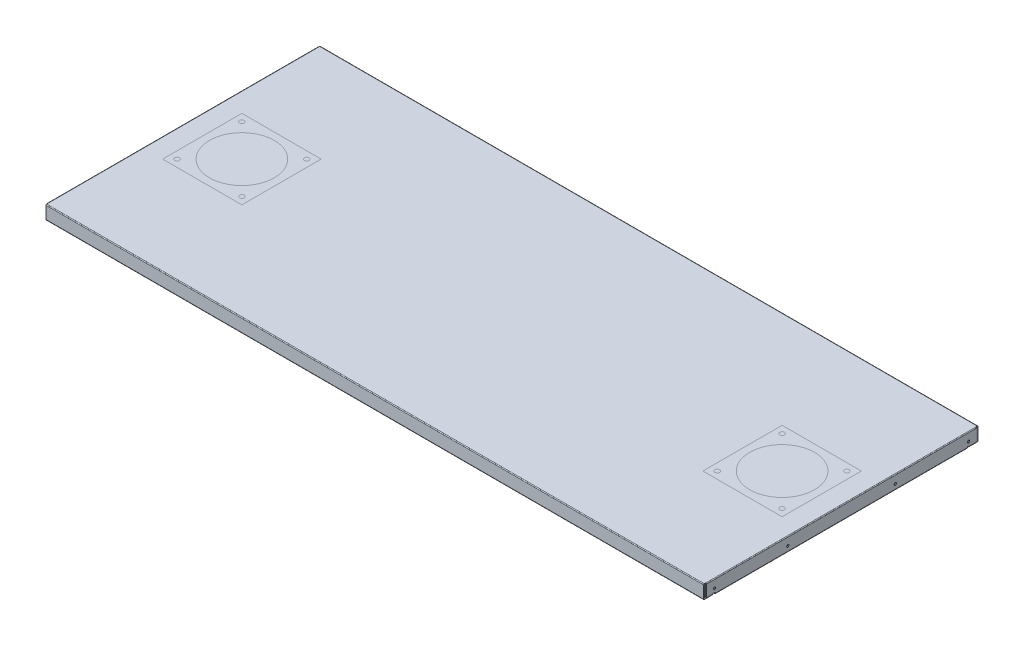
from build123d import *
from build123d.topology import SkipClean

# Parameters (mm, degrees)
BOSS_EXTRUDE1_DEPTH       = 912.8125
BOSS_EXTRUDE2_DEPTH       = 375.44375
BOSS_EXTRUDE2_2_DEPTH     = 375.44375
CUT_EXTRUDE1_DEPTH        = 1870.255613749
CUT_EXTRUDE1_DEPTH_BACK   = 1870.255613749
FILLET1_R                 = 2.06375
FILLET2_R                 = 0.79375
CUT_EXTRUDE4_DEPTH        = 2019.709476188
CUT_EXTRUDE4_DEPTH_BACK   = 2019.709476188
SKETCH10_R                = 3.175
SKETCH11_R                = 3.175
CUT_EXTRUDE5_DEPTH        = 6.35
SKETCH_PATTERN2_START     = -20.32
SKETCH_PATTERN2_OUTLINE_R = 3.175
SKETCH_PATTERN2_DEPTH     = 2.65684
CUT_EXTRUDE6_DEPTH        = 6.35
SKETCH_PATTERN3_START     = -20.32
SKETCH_PATTERN3_DEPTH     = 2.65684
BOSS_EXTRUDE4_DEPTH       = 375.840625
CUT_EXTRUDE7_DEPTH        = 992.742345256
CUT_EXTRUDE7_DEPTH_BACK   = 992.742345256
SKETCH17_R                = 6.35
SKETCH17_R_2              = 3.175
SKETCH18_R                = 5.55625
SKETCH18_R_2              = 3.175
BOSS_EXTRUDE5_DEPTH       = 6.7437
FILLET3_R                 = 3.175
LPATTERN1_COUNT           = 2
LPATTERN1_PITCH           = 1104.10879


# Read off the part's stored shape, not the designer's step: Sketch-Pattern2, Sketch-Pattern3
with BuildPart() as part:
    # Sketch7 → Boss-Extrude1 (new, symmetric)
    with BuildSketch(Plane(origin=(0, 0, 0), x_dir=(0, 0, -1), z_dir=(1, 0, 0))):
        Polygon((-381, 17.78), (381, 17.78), (381, -20.32), (354.95992, -20.32), (354.95992, -17.66316), (378.34316, -17.66316), (378.34316, 15.12316), (-378.34316, 15.12316), (-378.34316, -17.66316), (-354.95992, -17.66316), (-354.95992, -20.32), (-381, -20.32), align=None)
    extrude(amount=BOSS_EXTRUDE1_DEPTH, both=True)


with BuildPart() as body_2:
    # Sketch8 → Boss-Extrude2 (new, symmetric)
    with BuildSketch(Plane.XY):
        Polygon((-914.95118, 17.78), (-914.95118, -20.32), (-886.21362, -20.32), (-886.21362, -17.66316), (-912.29434, -17.66316), (-912.29434, 15.12316), (-908.60118, 15.12316), (-908.60118, 17.78), align=None)
    extrude(amount=BOSS_EXTRUDE2_DEPTH, both=True)


with BuildPart() as body_3:
    # Sketch8 → Boss-Extrude2 2 (new, symmetric)
    with BuildSketch(Plane.XY):
        Polygon((886.21362, -17.66316), (886.21362, -20.32), (914.95118, -20.32), (914.95118, 17.78), (908.60118, 17.78), (908.60118, 15.12316), (912.29434, 15.12316), (912.29434, -17.66316), align=None)
    extrude(amount=BOSS_EXTRUDE2_2_DEPTH, both=True)


with BuildPart() as cut_extrude1_tool:
    # Sketch9 → Cut-Extrude1 (new, two sides: drawn at the far end of the back side and taken through both)
    with BuildSketch(Plane.ZY.offset(914.95118).offset(-CUT_EXTRUDE1_DEPTH_BACK)):
        Polygon((-381, 17.78), (-375.47296, 17.78), (-375.47296, -16.10614), (-350.06788, -16.10614), (-350.06788, -20.32), (-381, -20.32), align=None)
        Polygon((381, -20.32), (381, 17.78), (375.47296, 17.78), (375.47296, -16.10614), (350.06788, -16.10614), (350.06788, -20.32), align=None)
    extrude(amount=CUT_EXTRUDE1_DEPTH + CUT_EXTRUDE1_DEPTH_BACK)


with BuildPart() as body_2_1:
    add(body_2.part)

    # Cut-Extrude1: cut by cut_extrude1_tool
    add(cut_extrude1_tool.part, mode=Mode.SUBTRACT)


with BuildPart() as body_3_1:
    add(body_3.part)

    # Cut-Extrude1: cut by cut_extrude1_tool
    add(cut_extrude1_tool.part, mode=Mode.SUBTRACT)


with BuildPart() as body_2_2:
    add(body_2_1.part)

    # Combine1: union part, body 3
    add(part.part)
    add(body_3_1.part)

    # Fillet1
    fillet1_edges = [body_2_2.edges().sort_by_distance(p)[0] for p in [
        (-914.95118, 17.78, 0),
        (-914.95118, -20.32, 0),
        (0, -20.32, -381),
        (914.95118, 17.78, 0),
        (0, 17.78, -381),
        (0, 17.78, 381),
        (0, -20.32, 381),
        (914.95118, -20.32, 0),
    ]]
    fillet(fillet1_edges, radius=FILLET1_R)

    # Fillet2
    fillet2_edges = [body_2_2.edges().sort_by_distance(p)[0] for p in [
        (-912.29434, 15.12316, 0),
        (-912.29434, -17.66316, 0),
        (0, 15.12316, 378.34316),
        (0, 15.12316, -378.34316),
        (0, -17.66316, -378.34316),
        (0, -17.66316, 378.34316),
        (912.29434, 15.12316, 0),
        (912.29434, -17.66316, 0),
    ]]
    fillet(fillet2_edges, radius=FILLET2_R)

    # Sketch10 → Cut-Extrude4 (cut, two sides: drawn at the far end of the back side and taken through both)
    with BuildSketch(Plane(origin=(914.95118, 742.23118, 0), x_dir=(0, 1, 0), z_dir=(-1, 0, 0)).offset(-CUT_EXTRUDE4_DEPTH_BACK)):
        with Locations(Location((-747.55756, -352.425, 0), (0, 0, 270))):
            Circle(SKETCH10_R)
        with Locations(Location((-747.55756, -149.225, 0), (0, 0, 270))):
            Circle(SKETCH10_R)
        with Locations(Location((-747.55756, 352.425, 0), (0, 0, 270))):
            Circle(SKETCH10_R)
        with Locations(Location((-747.55756, 149.225, 0), (0, 0, 270))):
            Circle(SKETCH10_R)
    extrude(amount=CUT_EXTRUDE4_DEPTH + CUT_EXTRUDE4_DEPTH_BACK, mode=Mode.SUBTRACT)

    # Sketch11 → Cut-Extrude5 (cut)
    with BuildSketch(Plane.XZ.offset(20.32)):
        with Locations(Location((-892.32994, -366.7125, 0), (0, 0, 270))):
            Circle(SKETCH11_R)
    extrude(amount=-CUT_EXTRUDE5_DEPTH, mode=Mode.SUBTRACT)

    # Sketch-Pattern2 outline → Sketch-Pattern2 (cut)
    with BuildSketch(Plane(origin=(0, 0, 0), x_dir=(1, 0, 0), z_dir=(0, 1, 0)).offset(SKETCH_PATTERN2_START)):
        with Locations((894.9563, 46.01337)):
            Circle(SKETCH_PATTERN2_OUTLINE_R)
        with Locations((894.9563, 214.28837)):
            Circle(SKETCH_PATTERN2_OUTLINE_R)
        with Locations((894.9563, -46.01337)):
            Circle(SKETCH_PATTERN2_OUTLINE_R)
        with Locations((894.9563, -214.28837)):
            Circle(SKETCH_PATTERN2_OUTLINE_R)
        with Locations((-892.32994, -366.7125)):
            Circle(SKETCH_PATTERN2_OUTLINE_R)
        with Locations((-854.22994, -366.7125)):
            Circle(SKETCH_PATTERN2_OUTLINE_R)
        with Locations((854.22994, -366.7125)):
            Circle(SKETCH_PATTERN2_OUTLINE_R)
        with Locations((892.32994, -366.7125)):
            Circle(SKETCH_PATTERN2_OUTLINE_R)
        with Locations((892.32994, 366.7125)):
            Circle(SKETCH_PATTERN2_OUTLINE_R)
        with Locations((854.22994, 366.7125)):
            Circle(SKETCH_PATTERN2_OUTLINE_R)
        with Locations((-854.22994, 366.7125)):
            Circle(SKETCH_PATTERN2_OUTLINE_R)
        with Locations((-894.9563, -46.01337)):
            Circle(SKETCH_PATTERN2_OUTLINE_R)
        with Locations((-894.9563, 214.28837)):
            Circle(SKETCH_PATTERN2_OUTLINE_R)
        with Locations((-894.9563, 46.01337)):
            Circle(SKETCH_PATTERN2_OUTLINE_R)
        with Locations((-894.9563, -214.28837)):
            Circle(SKETCH_PATTERN2_OUTLINE_R)
    extrude(amount=SKETCH_PATTERN2_DEPTH, mode=Mode.SUBTRACT)

    # Sketch12 → Cut-Extrude6 (cut)
    with BuildSketch(Plane.XZ.offset(20.32)):
        with BuildLine():
            Line((-820.10504, -364.3376), (-820.10504, -369.0874))
            ThreePointArc((-820.10504, -369.0874), (-816.12994, -373.0625), (-812.15484, -369.0874))
            Line((-812.15484, -369.0874), (-812.15484, -364.3376))
            ThreePointArc((-812.15484, -364.3376), (-816.12994, -360.3625), (-820.10504, -364.3376))
        make_face()
    extrude(amount=-CUT_EXTRUDE6_DEPTH, mode=Mode.SUBTRACT)

    # Sketch-Pattern3 outline → Sketch-Pattern3 (cut)
    with BuildSketch(Plane(origin=(0, 0, 0), x_dir=(1, 0, 0), z_dir=(0, 1, 0)).offset(SKETCH_PATTERN3_START)):
        with BuildLine():
            ThreePointArc((-812.15484, -364.3376), (-816.12994, -360.3625), (-820.10504, -364.3376))
            Line((-820.10504, -364.3376), (-820.10504, -369.0874))
            ThreePointArc((-820.10504, -369.0874), (-816.12994, -373.0625), (-812.15484, -369.0874))
            Line((-812.15484, -369.0874), (-812.15484, -364.3376))
        make_face()
        with BuildLine():
            ThreePointArc((670.725735, -364.3376), (666.750635, -360.3625), (662.775535, -364.3376))
            Line((662.775535, -364.3376), (662.775535, -369.0874))
            ThreePointArc((662.775535, -369.0874), (666.750635, -373.0625), (670.725735, -369.0874))
            Line((670.725735, -369.0874), (670.725735, -364.3376))
        make_face()
        with BuildLine():
            ThreePointArc((670.725735, 369.0874), (666.750635, 373.0625), (662.775535, 369.0874))
            Line((662.775535, 369.0874), (662.775535, 364.3376))
            ThreePointArc((662.775535, 364.3376), (666.750635, 360.3625), (670.725735, 364.3376))
            Line((670.725735, 364.3376), (670.725735, 369.0874))
        make_face()
        with BuildLine():
            ThreePointArc((556.029495, -364.3376), (552.054395, -360.3625), (548.079295, -364.3376))
            Line((548.079295, -364.3376), (548.079295, -369.0874))
            ThreePointArc((548.079295, -369.0874), (552.054395, -373.0625), (556.029495, -369.0874))
            Line((556.029495, -369.0874), (556.029495, -364.3376))
        make_face()
        with BuildLine():
            ThreePointArc((556.029495, 369.0874), (552.054395, 373.0625), (548.079295, 369.0874))
            Line((548.079295, 369.0874), (548.079295, 364.3376))
            ThreePointArc((548.079295, 364.3376), (552.054395, 360.3625), (556.029495, 364.3376))
            Line((556.029495, 364.3376), (556.029495, 369.0874))
        make_face()
        with BuildLine():
            ThreePointArc((480.225735, -364.3376), (476.250635, -360.3625), (472.275535, -364.3376))
            Line((472.275535, -364.3376), (472.275535, -369.0874))
            ThreePointArc((472.275535, -369.0874), (476.250635, -373.0625), (480.225735, -369.0874))
            Line((480.225735, -369.0874), (480.225735, -364.3376))
        make_face()
        with BuildLine():
            ThreePointArc((480.225735, 369.0874), (476.250635, 373.0625), (472.275535, 369.0874))
            Line((472.275535, 369.0874), (472.275535, 364.3376))
            ThreePointArc((472.275535, 364.3376), (476.250635, 360.3625), (480.225735, 364.3376))
            Line((480.225735, 364.3376), (480.225735, 369.0874))
        make_face()
        with BuildLine():
            ThreePointArc((439.898155, -364.3376), (435.923055, -360.3625), (431.947955, -364.3376))
            Line((431.947955, -364.3376), (431.947955, -369.0874))
            ThreePointArc((431.947955, -369.0874), (435.923055, -373.0625), (439.898155, -369.0874))
            Line((439.898155, -369.0874), (439.898155, -364.3376))
        make_face()
        with BuildLine():
            ThreePointArc((439.898155, 369.0874), (435.923055, 373.0625), (431.947955, 369.0874))
            Line((431.947955, 369.0874), (431.947955, 364.3376))
            ThreePointArc((431.947955, 364.3376), (435.923055, 360.3625), (439.898155, 364.3376))
            Line((439.898155, 364.3376), (439.898155, 369.0874))
        make_face()
        with BuildLine():
            ThreePointArc((99.2251, -364.3376), (95.25, -360.3625), (91.2749, -364.3376))
            Line((91.2749, -364.3376), (91.2749, -369.0874))
            ThreePointArc((91.2749, -369.0874), (95.25, -373.0625), (99.2251, -369.0874))
            Line((99.2251, -369.0874), (99.2251, -364.3376))
        make_face()
        with BuildLine():
            ThreePointArc((99.2251, 369.0874), (95.25, 373.0625), (91.2749, 369.0874))
            Line((91.2749, 369.0874), (91.2749, 364.3376))
            ThreePointArc((91.2749, 364.3376), (95.25, 360.3625), (99.2251, 364.3376))
            Line((99.2251, 364.3376), (99.2251, 369.0874))
        make_face()
        with BuildLine():
            ThreePointArc((-91.2749, -364.3376), (-95.25, -360.3625), (-99.2251, -364.3376))
            Line((-99.2251, -364.3376), (-99.2251, -369.0874))
            ThreePointArc((-99.2251, -369.0874), (-95.25, -373.0625), (-91.2749, -369.0874))
            Line((-91.2749, -369.0874), (-91.2749, -364.3376))
        make_face()
        with BuildLine():
            ThreePointArc((-91.2749, 369.0874), (-95.25, 373.0625), (-99.2251, 369.0874))
            Line((-99.2251, 369.0874), (-99.2251, 364.3376))
            ThreePointArc((-99.2251, 364.3376), (-95.25, 360.3625), (-91.2749, 364.3376))
            Line((-91.2749, 364.3376), (-91.2749, 369.0874))
        make_face()
        with BuildLine():
            ThreePointArc((-186.129295, -364.3376), (-190.104395, -360.3625), (-194.079495, -364.3376))
            Line((-194.079495, -364.3376), (-194.079495, -369.0874))
            ThreePointArc((-194.079495, -369.0874), (-190.104395, -373.0625), (-186.129295, -369.0874))
            Line((-186.129295, -369.0874), (-186.129295, -364.3376))
        make_face()
        with BuildLine():
            ThreePointArc((-186.129295, 369.0874), (-190.104395, 373.0625), (-194.079495, 369.0874))
            Line((-194.079495, 369.0874), (-194.079495, 364.3376))
            ThreePointArc((-194.079495, 364.3376), (-190.104395, 360.3625), (-186.129295, 364.3376))
            Line((-186.129295, 364.3376), (-186.129295, 369.0874))
        make_face()
        with BuildLine():
            ThreePointArc((289.725735, -364.3376), (285.750635, -360.3625), (281.775535, -364.3376))
            Line((281.775535, -364.3376), (281.775535, -369.0874))
            ThreePointArc((281.775535, -369.0874), (285.750635, -373.0625), (289.725735, -369.0874))
            Line((289.725735, -369.0874), (289.725735, -364.3376))
        make_face()
        with BuildLine():
            ThreePointArc((289.725735, 369.0874), (285.750635, 373.0625), (281.775535, 369.0874))
            Line((281.775535, 369.0874), (281.775535, 364.3376))
            ThreePointArc((281.775535, 364.3376), (285.750635, 360.3625), (289.725735, 364.3376))
            Line((289.725735, 364.3376), (289.725735, 369.0874))
        make_face()
        with BuildLine():
            ThreePointArc((194.079495, -364.3376), (190.104395, -360.3625), (186.129295, -364.3376))
            Line((186.129295, -364.3376), (186.129295, -369.0874))
            ThreePointArc((186.129295, -369.0874), (190.104395, -373.0625), (194.079495, -369.0874))
            Line((194.079495, -369.0874), (194.079495, -364.3376))
        make_face()
        with BuildLine():
            ThreePointArc((194.079495, 369.0874), (190.104395, 373.0625), (186.129295, 369.0874))
            Line((186.129295, 369.0874), (186.129295, 364.3376))
            ThreePointArc((186.129295, 364.3376), (190.104395, 360.3625), (194.079495, 364.3376))
            Line((194.079495, 364.3376), (194.079495, 369.0874))
        make_face()
        with BuildLine():
            ThreePointArc((-281.775535, -364.3376), (-285.750635, -360.3625), (-289.725735, -364.3376))
            Line((-289.725735, -364.3376), (-289.725735, -369.0874))
            ThreePointArc((-289.725735, -369.0874), (-285.750635, -373.0625), (-281.775535, -369.0874))
            Line((-281.775535, -369.0874), (-281.775535, -364.3376))
        make_face()
        with BuildLine():
            ThreePointArc((-281.775535, 369.0874), (-285.750635, 373.0625), (-289.725735, 369.0874))
            Line((-289.725735, 369.0874), (-289.725735, 364.3376))
            ThreePointArc((-289.725735, 364.3376), (-285.750635, 360.3625), (-281.775535, 364.3376))
            Line((-281.775535, 364.3376), (-281.775535, 369.0874))
        make_face()
        with BuildLine():
            ThreePointArc((-431.947955, -364.3376), (-435.923055, -360.3625), (-439.898155, -364.3376))
            Line((-439.898155, -364.3376), (-439.898155, -369.0874))
            ThreePointArc((-439.898155, -369.0874), (-435.923055, -373.0625), (-431.947955, -369.0874))
            Line((-431.947955, -369.0874), (-431.947955, -364.3376))
        make_face()
        with BuildLine():
            ThreePointArc((-431.947955, 369.0874), (-435.923055, 373.0625), (-439.898155, 369.0874))
            Line((-439.898155, 369.0874), (-439.898155, 364.3376))
            ThreePointArc((-439.898155, 364.3376), (-435.923055, 360.3625), (-431.947955, 364.3376))
            Line((-431.947955, 364.3376), (-431.947955, 369.0874))
        make_face()
        with BuildLine():
            ThreePointArc((-472.275535, -364.3376), (-476.250635, -360.3625), (-480.225735, -364.3376))
            Line((-480.225735, -364.3376), (-480.225735, -369.0874))
            ThreePointArc((-480.225735, -369.0874), (-476.250635, -373.0625), (-472.275535, -369.0874))
            Line((-472.275535, -369.0874), (-472.275535, -364.3376))
        make_face()
        with BuildLine():
            ThreePointArc((-472.275535, 369.0874), (-476.250635, 373.0625), (-480.225735, 369.0874))
            Line((-480.225735, 369.0874), (-480.225735, 364.3376))
            ThreePointArc((-480.225735, 364.3376), (-476.250635, 360.3625), (-472.275535, 364.3376))
            Line((-472.275535, 364.3376), (-472.275535, 369.0874))
        make_face()
        with BuildLine():
            ThreePointArc((-548.079295, -364.3376), (-552.054395, -360.3625), (-556.029495, -364.3376))
            Line((-556.029495, -364.3376), (-556.029495, -369.0874))
            ThreePointArc((-556.029495, -369.0874), (-552.054395, -373.0625), (-548.079295, -369.0874))
            Line((-548.079295, -369.0874), (-548.079295, -364.3376))
        make_face()
        with BuildLine():
            ThreePointArc((-548.079295, 369.0874), (-552.054395, 373.0625), (-556.029495, 369.0874))
            Line((-556.029495, 369.0874), (-556.029495, 364.3376))
            ThreePointArc((-556.029495, 364.3376), (-552.054395, 360.3625), (-548.079295, 364.3376))
            Line((-548.079295, 364.3376), (-548.079295, 369.0874))
        make_face()
        with BuildLine():
            ThreePointArc((-662.775535, -364.3376), (-666.750635, -360.3625), (-670.725735, -364.3376))
            Line((-670.725735, -364.3376), (-670.725735, -369.0874))
            ThreePointArc((-670.725735, -369.0874), (-666.750635, -373.0625), (-662.775535, -369.0874))
            Line((-662.775535, -369.0874), (-662.775535, -364.3376))
        make_face()
        with BuildLine():
            ThreePointArc((-662.775535, 369.0874), (-666.750635, 373.0625), (-670.725735, 369.0874))
            Line((-670.725735, 369.0874), (-670.725735, 364.3376))
            ThreePointArc((-670.725735, 364.3376), (-666.750635, 360.3625), (-662.775535, 364.3376))
            Line((-662.775535, 364.3376), (-662.775535, 369.0874))
        make_face()
        with BuildLine():
            ThreePointArc((-716.90484, -364.3376), (-720.87994, -360.3625), (-724.85504, -364.3376))
            Line((-724.85504, -364.3376), (-724.85504, -369.0874))
            ThreePointArc((-724.85504, -369.0874), (-720.87994, -373.0625), (-716.90484, -369.0874))
            Line((-716.90484, -369.0874), (-716.90484, -364.3376))
        make_face()
        with BuildLine():
            ThreePointArc((-716.90484, 369.0874), (-720.87994, 373.0625), (-724.85504, 369.0874))
            Line((-724.85504, 369.0874), (-724.85504, 364.3376))
            ThreePointArc((-724.85504, 364.3376), (-720.87994, 360.3625), (-716.90484, 364.3376))
            Line((-716.90484, 364.3376), (-716.90484, 369.0874))
        make_face()
        with BuildLine():
            ThreePointArc((724.85504, -364.3376), (720.87994, -360.3625), (716.90484, -364.3376))
            Line((716.90484, -364.3376), (716.90484, -369.0874))
            ThreePointArc((716.90484, -369.0874), (720.87994, -373.0625), (724.85504, -369.0874))
            Line((724.85504, -369.0874), (724.85504, -364.3376))
        make_face()
        with BuildLine():
            ThreePointArc((724.85504, 369.0874), (720.87994, 373.0625), (716.90484, 369.0874))
            Line((716.90484, 369.0874), (716.90484, 364.3376))
            ThreePointArc((716.90484, 364.3376), (720.87994, 360.3625), (724.85504, 364.3376))
            Line((724.85504, 364.3376), (724.85504, 369.0874))
        make_face()
        with BuildLine():
            ThreePointArc((820.10504, -364.3376), (816.12994, -360.3625), (812.15484, -364.3376))
            Line((812.15484, -364.3376), (812.15484, -369.0874))
            ThreePointArc((812.15484, -369.0874), (816.12994, -373.0625), (820.10504, -369.0874))
            Line((820.10504, -369.0874), (820.10504, -364.3376))
        make_face()
        with BuildLine():
            ThreePointArc((820.10504, 369.0874), (816.12994, 373.0625), (812.15484, 369.0874))
            Line((812.15484, 369.0874), (812.15484, 364.3376))
            ThreePointArc((812.15484, 364.3376), (816.12994, 360.3625), (820.10504, 364.3376))
            Line((820.10504, 364.3376), (820.10504, 369.0874))
        make_face()
    extrude(amount=SKETCH_PATTERN3_DEPTH, mode=Mode.SUBTRACT)


with BuildPart() as body_2_2_1:
    # Sketch16 → Boss-Extrude4 (new, symmetric)
    with BuildSketch(Plane.XY):
        with BuildLine():
            Line((-561.270785, -17.66316), (-533.313005, -17.66316))
            ThreePointArc((-533.313005, -17.66316), (-531.410986754, -16.875318246), (-530.623145, -14.9733))
            Line((-530.623145, -14.9733), (-530.623145, 11.70559))
            Line((-530.623145, 11.70559), (-532.520525, 11.70559))
            Line((-532.520525, 11.70559), (-532.520525, -14.9733))
            ThreePointArc((-532.520525, -14.9733), (-532.752637018, -15.533667982), (-533.313005, -15.76578))
            Line((-533.313005, -15.76578), (-561.270785, -15.76578))
            ThreePointArc((-561.270785, -15.76578), (-561.831152982, -15.533667982), (-562.063265, -14.9733))
            Line((-562.063265, -14.9733), (-562.063265, 11.70559))
            Line((-562.063265, 11.70559), (-563.960645, 11.70559))
            Line((-563.960645, 11.70559), (-563.960645, -14.9733))
            ThreePointArc((-563.960645, -14.9733), (-563.172803246, -16.875318246), (-561.270785, -17.66316))
        make_face()
    extrude(amount=BOSS_EXTRUDE4_DEPTH, both=True)

    # Sketch17 → Cut-Extrude7 (cut, two sides: drawn at the far end of the back side and taken through both)
    with BuildSketch(Plane.XZ.offset(17.66316).offset(-CUT_EXTRUDE7_DEPTH_BACK)):
        with Locations(Location((-547.291895, 353.615625, 0), (0, 0, 270))):
            Circle(SKETCH17_R)
        with Locations(Location((-552.054395, 366.315625, 0), (0, 0, 270))):
            Circle(SKETCH17_R_2)
        with Locations(Location((-542.529395, 315.9125, 0), (0, 0, 270))):
            Circle(SKETCH17_R_2)
        with Locations(Location((-542.529395, 0, 0), (0, 0, 270))):
            Circle(SKETCH17_R_2)
        with Locations(Location((-542.529395, -315.9125, 0), (0, 0, 270))):
            Circle(SKETCH17_R_2)
        with Locations(Location((-552.054395, -366.315625, 0), (0, 0, 270))):
            Circle(SKETCH17_R_2)
        with Locations(Location((-547.291895, -353.615625, 0), (0, 0, 270))):
            Circle(SKETCH17_R)
    extrude(amount=CUT_EXTRUDE7_DEPTH + CUT_EXTRUDE7_DEPTH_BACK, mode=Mode.SUBTRACT)

    # Sketch18 → Boss-Extrude5 (add)
    # profile 1 of 5: a face of its own
    with SkipClean():  # the faces are left unmerged after this step: merging them gives an invalid solid
        with BuildSketch(Plane.XZ.offset(17.66316)):
            with Locations((-552.054395, 366.315625)):
                Circle(SKETCH18_R)
            with Locations((-552.054395, 366.315625)):
                Circle(SKETCH18_R_2, mode=Mode.SUBTRACT)
        # profile 2 of 5: a face of its own
        with BuildSketch(Plane.XZ.offset(17.66316)):
            with Locations((-542.529395, 315.9125)):
                Circle(SKETCH18_R)
            with Locations((-542.529395, 315.9125)):
                Circle(SKETCH18_R_2, mode=Mode.SUBTRACT)
        # profile 3 of 5: a face of its own
        with BuildSketch(Plane.XZ.offset(17.66316)):
            with Locations((-542.529395, 0)):
                Circle(SKETCH18_R)
            with Locations((-542.529395, 0)):
                Circle(SKETCH18_R_2, mode=Mode.SUBTRACT)
        # profile 4 of 5: a face of its own
        with BuildSketch(Plane.XZ.offset(17.66316)):
            with Locations(Location((-542.529395, -315.9125, 0), (0, 0, 270))):
                Circle(SKETCH18_R)
            with Locations((-542.529395, -315.9125)):
                Circle(SKETCH18_R_2, mode=Mode.SUBTRACT)
        # profile 5 of 5: a face of its own
        with BuildSketch(Plane.XZ.offset(17.66316)):
            with Locations(Location((-552.054395, -366.315625, 0), (0, 0, 270))):
                Circle(SKETCH18_R)
            with Locations((-552.054395, -366.315625)):
                Circle(SKETCH18_R_2, mode=Mode.SUBTRACT)
        extrude(amount=-BOSS_EXTRUDE5_DEPTH)
    add(body_2_2_1.part.scale(1), mode=Mode.REPLACE)  # the faces are merged on a copy

    # Fillet3
    fillet3_edges = [body_2_2_1.edges().sort_by_distance(p)[0] for p in [
        (-563.011955, 11.70559, -375.840625),
        (-531.571835, 11.70559, -375.840625),
        (-563.011955, 11.70559, 375.840625),
        (-531.571835, 11.70559, 375.840625),
    ]]
    fillet(fillet3_edges, radius=FILLET3_R)


with BuildPart() as lpattern1_1:
    # LPattern1: pattern copy
    add(body_2_2_1.part.moved(Location(Vector(1, 0, 0) * (1 * LPATTERN1_PITCH))))


solid = Compound([body_2_2.part, body_2_2_1.part, lpattern1_1.part])
